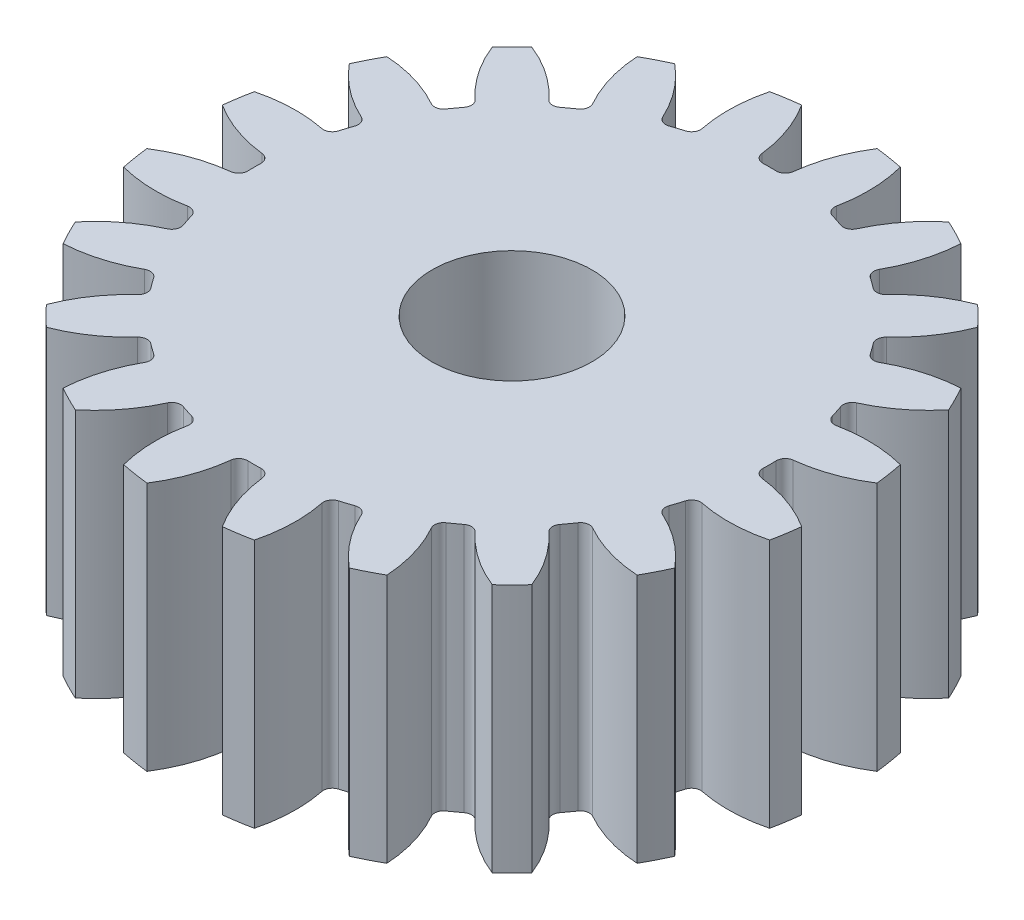
from build123d import *

# Parameters (mm, degrees)
SKIZZE1_R                       = 6.6
SKIZZE1_R_2                     = 1.6
AUFSATZ_LINEAR_AUSTRAGEN1_DEPTH = 5
SCHNITT_LINEAR_AUSTRAGEN1_DEPTH = 11.588673194
VERRUNDUNG1_R                   = 0.18
KREISMUSTER1_COUNT              = 20
VERRUNDUNG1_OF_KREISMUSTER1_R   = 0.18


with BuildPart() as part:
    # Skizze1 → Aufsatz-Linear austragen1 (new body)
    with BuildSketch(Plane(origin=(0, 0, 0), x_dir=(1, 0, 0), z_dir=(0, 1, 0))):
        Circle(SKIZZE1_R)
        Circle(SKIZZE1_R_2, mode=Mode.SUBTRACT)
    extrude(amount=AUFSATZ_LINEAR_AUSTRAGEN1_DEPTH)

    # Skizze2 → Schnitt-Linear austragen1 (cut, through all)
    with BuildSketch(Plane(origin=(0, 5, 0), x_dir=(1, 0, 0), z_dir=(0, 1, 0))):
        with BuildLine():
            ThreePointArc((-0.884105045, 6.742281385), (-0.473900419, 5.990105194), (-0.299386591, 5.151307375))
            ThreePointArc((-0.299386591, 5.151307375), (0, 5.16), (0.299386591, 5.151307375))
            ThreePointArc((0.299386591, 5.151307375), (0.473900419, 5.990105194), (0.884105045, 6.742281385))
            ThreePointArc((0.884105045, 6.742281385), (0, 6.8), (-0.884105045, 6.742281385))
        make_face()
    schnitt_linear_austragen1 = extrude(amount=-SCHNITT_LINEAR_AUSTRAGEN1_DEPTH, mode=Mode.SUBTRACT)

    # Verrundung1
    verrundung1_edges = [part.edges().sort_by_distance(p)[0] for p in [
        (0.299386591, 2.5, -5.151307375),
        (-0.299386591, 2.5, -5.151307375),
    ]]
    fillet(verrundung1_edges, radius=VERRUNDUNG1_R)

    # Kreismuster1: Schnitt-Linear austragen1 ×20 about axis
    kreismuster1_axis = Axis((0, 5, 0), (0, -1, 0))
    for i in range(1, KREISMUSTER1_COUNT):
        add(schnitt_linear_austragen1.rotate(kreismuster1_axis, i * 360 / KREISMUSTER1_COUNT), mode=Mode.SUBTRACT)

    # Verrundung1 of Kreismuster1
    verrundung1_of_kreismuster1_edges = [part.edges().sort_by_distance(p)[0] for p in [
        (1.87657509, 2.5, -4.806668902),
        (1.307107954, 2.5, -4.991699991),
        (3.270071345, 2.5, -3.991520187),
        (2.785653665, 2.5, -4.343470232),
        (4.343470232, 2.5, -2.785653665),
        (3.991520187, 2.5, -3.270071345),
        (4.991699991, 2.5, -1.307107954),
        (4.806668902, 2.5, -1.87657509),
        (5.151307375, 2.5, 0.299386591),
        (5.151307375, 2.5, -0.299386591),
        (4.806668902, 2.5, 1.87657509),
        (4.991699991, 2.5, 1.307107954),
        (3.991520187, 2.5, 3.270071345),
        (4.343470232, 2.5, 2.785653665),
        (2.785653665, 2.5, 4.343470232),
        (3.270071345, 2.5, 3.991520187),
        (1.307107954, 2.5, 4.991699991),
        (1.87657509, 2.5, 4.806668902),
        (-0.299386591, 2.5, 5.151307375),
        (0.299386591, 2.5, 5.151307375),
        (-1.87657509, 2.5, 4.806668902),
        (-1.307107954, 2.5, 4.991699991),
        (-3.270071345, 2.5, 3.991520187),
        (-2.785653665, 2.5, 4.343470232),
        (-4.343470232, 2.5, 2.785653665),
        (-3.991520187, 2.5, 3.270071345),
        (-4.991699991, 2.5, 1.307107954),
        (-4.806668902, 2.5, 1.87657509),
        (-5.151307375, 2.5, -0.299386591),
        (-5.151307375, 2.5, 0.299386591),
        (-4.806668902, 2.5, -1.87657509),
        (-4.991699991, 2.5, -1.307107954),
        (-3.991520187, 2.5, -3.270071345),
        (-4.343470232, 2.5, -2.785653665),
        (-2.785653665, 2.5, -4.343470232),
        (-3.270071345, 2.5, -3.991520187),
        (-1.307107954, 2.5, -4.991699991),
        (-1.87657509, 2.5, -4.806668902),
    ]]
    fillet(verrundung1_of_kreismuster1_edges, radius=VERRUNDUNG1_OF_KREISMUSTER1_R)


solid = part.part
